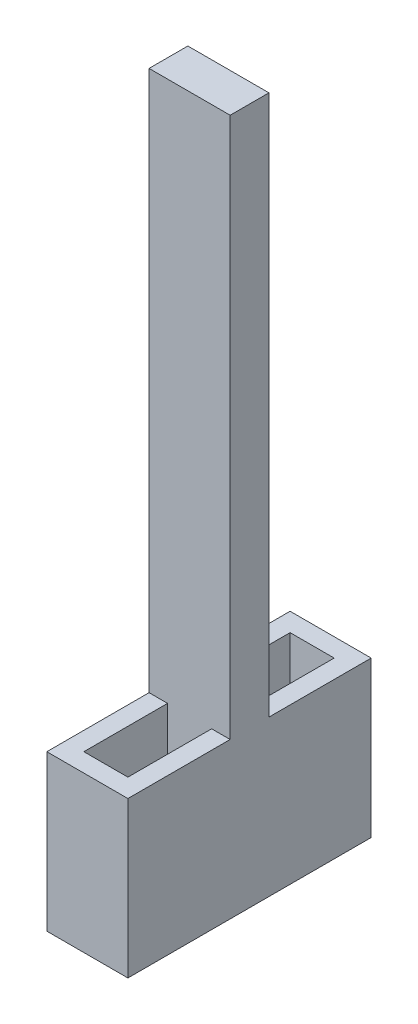
from build123d import *

# Parameters (mm, degrees)
BOSS_EXTRUDE1_DEPTH  = 1.5
BOSS_EXTRUDE5_DEPTH  = 10
SKETCH2_W            = 2.87
SKETCH2_H            = 2.87
BOSS_EXTRUDE2_DEPTH  = 10
SKETCH4_W            = 6
SKETCH4_H            = 6
CUT_EXTRUDE1_DEPTH   = 18.153716798
BOSS_EXTRUDE6_DEPTH  = 10
SKETCH8_W            = 6
SKETCH8_H            = 6
CUT_EXTRUDE3_DEPTH   = 18.153716798
BOSS_EXTRUDE8_DEPTH  = 10
SKETCH13_W           = 6
SKETCH13_H           = 2.87
BOSS_EXTRUDE12_DEPTH = 40


with BuildPart() as part:
    # Sketch1 → Boss-Extrude1 (new body)
    with BuildSketch(Plane(origin=(0, 0, 0), x_dir=(1, 0, 0), z_dir=(0, 1, 0))):
        Polygon((-3, 3), (-3, 9), (3, 9), (3, 3), (9, 3), (9, -3), (3, -3), (3, -9), (-3, -9), (-3, -3), (-9, -3), (-9, 3), align=None)
    extrude(amount=BOSS_EXTRUDE1_DEPTH)

    # Sketch3 → Boss-Extrude5 (add)
    with BuildSketch(Plane(origin=(0, 1.5, 0), x_dir=(1, 0, 0), z_dir=(0, 1, 0))):
        Polygon((-3, 3), (-9, 3), (-9, -3), (-3, -3), (-3, -9), (3, -9), (3, -3), (9, -3), (9, 3), (3, 3), (3, 9), (-3, 9), align=None)
        Polygon((-1.63, 1.63), (-7.63, 1.63), (-7.63, -1.63), (-1.63, -1.63), (-1.63, -7.63), (1.63, -7.63), (1.63, -1.63), (7.63, -1.63), (7.63, 1.63), (1.63, 1.63), (1.63, 7.63), (-1.63, 7.63), align=None, mode=Mode.SUBTRACT)
    extrude(amount=BOSS_EXTRUDE5_DEPTH)

    # Sketch2 → Boss-Extrude2 (add)
    with BuildSketch(Plane(origin=(0, 1.5, 0), x_dir=(1, 0, 0), z_dir=(0, 1, 0))):
        Rectangle(SKETCH2_W, SKETCH2_H)
    extrude(amount=BOSS_EXTRUDE2_DEPTH)

    # Sketch4 → Cut-Extrude1 (cut, through all)
    with BuildSketch(Plane(origin=(0, 11.5, 0), x_dir=(1, 0, 0), z_dir=(0, 1, 0))):
        with Locations((-6, 0)):
            Rectangle(SKETCH4_W, SKETCH4_H)
    extrude(amount=-CUT_EXTRUDE1_DEPTH, mode=Mode.SUBTRACT)

    # Sketch5 → Boss-Extrude6 (add)
    with BuildSketch(Plane(origin=(0, 11.5, 0), x_dir=(1, 0, 0), z_dir=(0, 1, 0))):
        Polygon((-3, 1.63), (-1.63, 1.63), (-1.63, 1.435), (-1.435, 1.435), (-1.435, -1.435), (-1.63, -1.435), (-1.63, -1.63), (-3, -1.63), align=None)
    extrude(amount=-BOSS_EXTRUDE6_DEPTH)

    # Sketch8 → Cut-Extrude3 (cut, through all)
    with BuildSketch(Plane(origin=(0, 11.5, 0), x_dir=(1, 0, 0), z_dir=(0, 1, 0))):
        with Locations((6, 0)):
            Rectangle(SKETCH8_W, SKETCH8_H)
    extrude(amount=-CUT_EXTRUDE3_DEPTH, mode=Mode.SUBTRACT)

    # Sketch9 → Boss-Extrude8 (add)
    with BuildSketch(Plane(origin=(0, 11.5, 0), x_dir=(1, 0, 0), z_dir=(0, 1, 0))):
        Polygon((1.435, -1.435), (1.435, 1.435), (1.63, 1.435), (1.63, 1.63), (3, 1.63), (3, -1.63), (1.63, -1.63), (1.63, -1.435), align=None)
    extrude(amount=-BOSS_EXTRUDE8_DEPTH)

    # Sketch13 → Boss-Extrude12 (add)
    with BuildSketch(Plane(origin=(0, 11.5, 0), x_dir=(1, 0, 0), z_dir=(0, 1, 0))):
        Rectangle(SKETCH13_W, SKETCH13_H)
    extrude(amount=BOSS_EXTRUDE12_DEPTH)


solid = part.part
